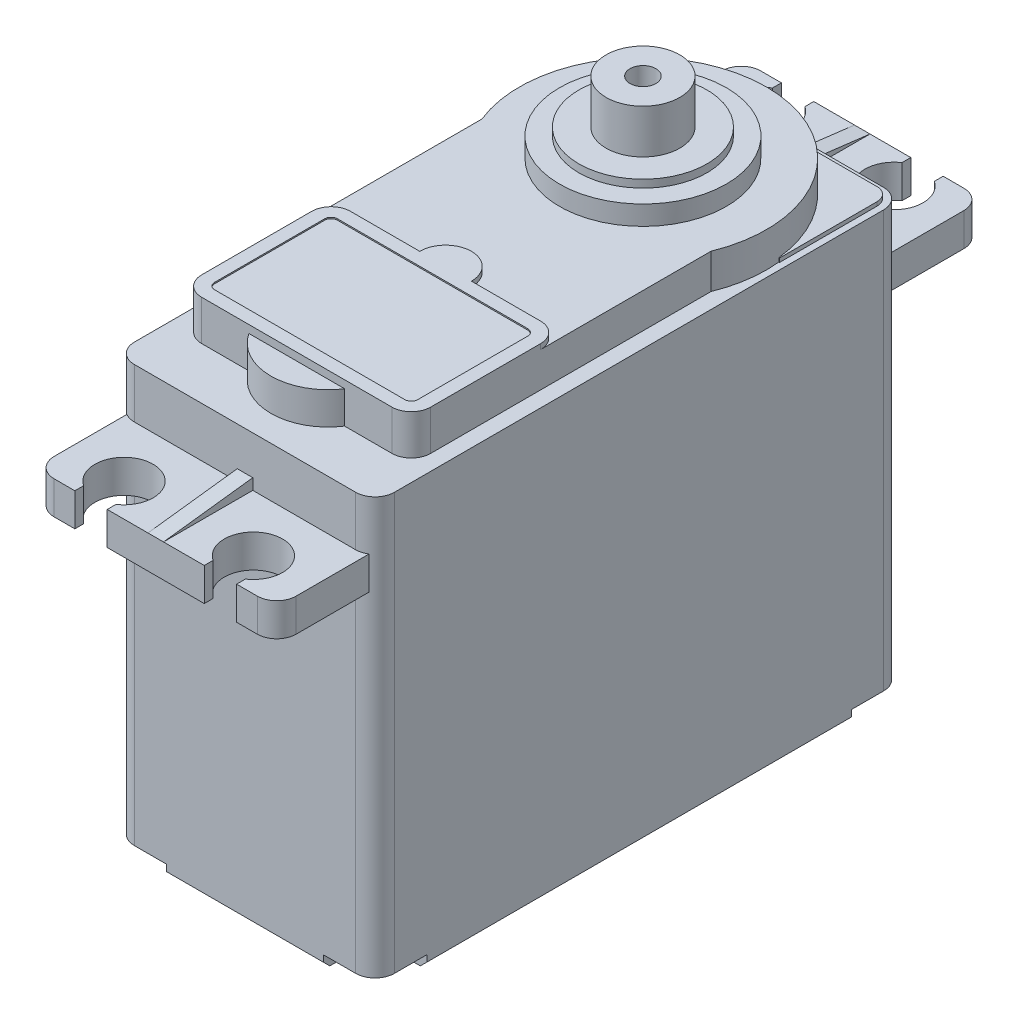
from build123d import *

# Parameters (mm, degrees)
BOSS_EXTRUDE1_DEPTH  = 33.2
BOSS_EXTRUDE2_DEPTH  = 2.55
BOSS_EXTRUDE11_DEPTH = 0.3
BOSS_EXTRUDE3_DEPTH  = 2.7
SKETCH6_R            = 4.4225
BOSS_EXTRUDE4_DEPTH  = 2.5
SKETCH7_R            = 6.45
BOSS_EXTRUDE5_DEPTH  = 1.5
SKETCH8_R            = 4.95
BOSS_EXTRUDE6_DEPTH  = 0.6
SKETCH10_R           = 2.85
BOSS_EXTRUDE7_DEPTH  = 3.4
SKETCH12_R           = 1
CUT_EXTRUDE1_DEPTH   = 5
BOSS_EXTRUDE9_DEPTH  = 0.4
BOSS_EXTRUDE10_DEPTH = 0.3
CHAMFER1_SIZE        = 0.5
CUT_EXTRUDE2_DEPTH   = 1
MIRROR2_COPY_1_DEPTH = 1
BOSS_EXTRUDE12_DEPTH = 0.6


with BuildPart() as part:
    # Sketch1 → Boss-Extrude1 (new body)
    with BuildSketch(Plane(origin=(0, 0, 0), x_dir=(1, 0, 0), z_dir=(0, 1, 0))):
        with BuildLine():
            Line((-8.55, -25.58), (8.55, -25.58))
            ThreePointArc((8.55, -25.58), (9.610660172, -25.140660172), (10.05, -24.08))
            Line((10.05, -24.08), (10.05, 13.72))
            ThreePointArc((10.05, 13.72), (9.610660172, 14.780660172), (8.55, 15.22))
            Line((8.55, 15.22), (-8.55, 15.22))
            ThreePointArc((-8.55, 15.22), (-9.610660172, 14.780660172), (-10.05, 13.72))
            Line((-10.05, 13.72), (-10.05, -24.08))
            ThreePointArc((-10.05, -24.08), (-9.610660172, -25.140660172), (-8.55, -25.58))
        make_face()
    extrude(amount=BOSS_EXTRUDE1_DEPTH)

    # Sketch4 → Boss-Extrude2 (add)
    with BuildSketch(Plane(origin=(0, 26.8, 0), x_dir=(1, 0, 0), z_dir=(0, 1, 0))):
        with BuildLine():
            Line((-6.25, 22.12), (-6.25, 21.440828693))
            ThreePointArc((-6.25, 21.440828693), (-5, 17.32), (-3.75, 21.440828693))
            Line((-3.75, 21.440828693), (-3.75, 22.12))
            Line((-3.75, 22.12), (3.75, 22.12))
            Line((3.75, 22.12), (3.75, 21.440828693))
            ThreePointArc((3.75, 21.440828693), (5, 17.32), (6.25, 21.440828693))
            Line((6.25, 21.440828693), (6.25, 22.12))
            Line((6.25, 22.12), (7.85, 22.12))
            ThreePointArc((7.85, 22.12), (8.910660172, 21.680660172), (9.35, 20.62))
            Line((9.35, 20.62), (9.35, -30.98))
            ThreePointArc((9.35, -30.98), (8.910660172, -32.040660172), (7.85, -32.48))
            Line((7.85, -32.48), (6.25, -32.48))
            Line((6.25, -32.48), (6.25, -31.800828693))
            ThreePointArc((6.25, -31.800828693), (5, -27.68), (3.75, -31.800828693))
            Line((3.75, -31.800828693), (3.75, -32.48))
            Line((3.75, -32.48), (-3.75, -32.48))
            Line((-3.75, -32.48), (-3.75, -31.800828693))
            ThreePointArc((-3.75, -31.800828693), (-5, -27.68), (-6.25, -31.800828693))
            Line((-6.25, -31.800828693), (-6.25, -32.48))
            Line((-6.25, -32.48), (-7.85, -32.48))
            ThreePointArc((-7.85, -32.48), (-8.910660172, -32.040660172), (-9.35, -30.98))
            Line((-9.35, -30.98), (-9.35, 20.62))
            ThreePointArc((-9.35, 20.62), (-8.910660172, 21.680660172), (-7.85, 22.12))
            Line((-7.85, 22.12), (-6.25, 22.12))
        make_face()
    extrude(amount=BOSS_EXTRUDE2_DEPTH)

    # Sketch16 → Boss-Extrude11 (add)
    with BuildSketch(Plane(origin=(0, 33.2, 0), x_dir=(1, 0, 0), z_dir=(0, 1, 0))):
        with BuildLine():
            Line((-9.55, 13.72), (-9.55, 6.17))
            Line((-9.55, 6.17), (9.55, 6.17))
            Line((9.55, 6.17), (9.55, 13.72))
            ThreePointArc((9.55, 13.72), (9.257106781, 14.427106781), (8.55, 14.72))
            Line((8.55, 14.72), (-8.55, 14.72))
            ThreePointArc((-8.55, 14.72), (-9.257106781, 14.427106781), (-9.55, 13.72))
        make_face()
    extrude(amount=BOSS_EXTRUDE11_DEPTH)

    # Sketch5 → Boss-Extrude3 (add)
    with BuildSketch(Plane(origin=(0, 33.2, 0), x_dir=(1, 0, 0), z_dir=(0, 1, 0))):
        with BuildLine():
            Line((-8.85, 1.581128311), (-8.85, -20.08))
            ThreePointArc((-8.85, -20.08), (-8.410660172, -21.140660172), (-7.35, -21.58))
            Line((-7.35, -21.58), (7.35, -21.58))
            ThreePointArc((7.35, -21.58), (8.410660172, -21.140660172), (8.85, -20.08))
            Line((8.85, -20.08), (8.85, 1.581128311))
            ThreePointArc((8.85, 1.581128311), (0, 14.72), (-8.85, 1.581128311))
        make_face()
    extrude(amount=BOSS_EXTRUDE3_DEPTH)

    # Sketch6 → Boss-Extrude4 (add)
    with BuildSketch(Plane(origin=(0, 33.2, 0), x_dir=(1, 0, 0), z_dir=(0, 1, 0))):
        with Locations((0, -19.1575)):
            Circle(SKETCH6_R)
    extrude(amount=BOSS_EXTRUDE4_DEPTH)

    # Sketch7 → Boss-Extrude5 (add)
    with BuildSketch(Plane(origin=(0, 35.9, 0), x_dir=(1, 0, 0), z_dir=(0, 1, 0))):
        with Locations((0, 5.17)):
            Circle(SKETCH7_R)
    extrude(amount=BOSS_EXTRUDE5_DEPTH)

    # Sketch8 → Boss-Extrude6 (add)
    with BuildSketch(Plane(origin=(0, 37.4, 0), x_dir=(1, 0, 0), z_dir=(0, 1, 0))):
        with Locations((0, 5.17)):
            Circle(SKETCH8_R)
    extrude(amount=BOSS_EXTRUDE6_DEPTH)

    # Sketch10 → Boss-Extrude7 (add)
    with BuildSketch(Plane(origin=(0, 38, 0), x_dir=(1, 0, 0), z_dir=(0, 1, 0))):
        with Locations((0, 5.17)):
            Circle(SKETCH10_R)
    extrude(amount=BOSS_EXTRUDE7_DEPTH)

    # Sketch12 → Cut-Extrude1 (cut)
    with BuildSketch(Plane(origin=(0, 41.4, 0), x_dir=(1, 0, 0), z_dir=(0, 1, 0))):
        with Locations((0, 5.17)):
            Circle(SKETCH12_R)
    extrude(amount=-CUT_EXTRUDE1_DEPTH, mode=Mode.SUBTRACT)

    # Sketch13 → Boss-Extrude9 (add)
    with BuildSketch(Plane(origin=(0, 35.9, 0), x_dir=(1, 0, 0), z_dir=(0, 1, 0))):
        with BuildLine():
            Line((-8.85, -11.58), (-8.85, -20.08))
            ThreePointArc((-8.85, -20.08), (-8.410660172, -21.140660172), (-7.35, -21.58))
            Line((-7.35, -21.58), (7.35, -21.58))
            ThreePointArc((7.35, -21.58), (8.410660172, -21.140660172), (8.85, -20.08))
            Line((8.85, -20.08), (8.85, -11.58))
            ThreePointArc((8.85, -11.58), (8.410660172, -10.519339828), (7.35, -10.08))
            Line((7.35, -10.08), (2, -10.08))
            ThreePointArc((2, -10.08), (0, -8.08), (-2, -10.08))
            Line((-2, -10.08), (-7.35, -10.08))
            ThreePointArc((-7.35, -10.08), (-8.410660172, -10.519339828), (-8.85, -11.58))
        make_face()
        with BuildLine():
            Line((-7.85, -11.58), (-7.85, -20.08))
            ThreePointArc((-7.85, -20.08), (-7.703553391, -20.433553391), (-7.35, -20.58))
            Line((-7.35, -20.58), (7.35, -20.58))
            ThreePointArc((7.35, -20.58), (7.703553391, -20.433553391), (7.85, -20.08))
            Line((7.85, -20.08), (7.85, -11.58))
            ThreePointArc((7.85, -11.58), (7.703553391, -11.226446609), (7.35, -11.08))
            Line((7.35, -11.08), (-7.35, -11.08))
            ThreePointArc((-7.35, -11.08), (-7.703553391, -11.226446609), (-7.85, -11.58))
        make_face(mode=Mode.SUBTRACT)
    extrude(amount=BOSS_EXTRUDE9_DEPTH)

    # Sketch14 → Boss-Extrude10 (add)
    with BuildSketch(Plane(origin=(0, 35.9, 0), x_dir=(1, 0, 0), z_dir=(0, 1, 0))):
        with BuildLine():
            Line((-7.85, -11.58), (-7.85, -20.08))
            ThreePointArc((-7.85, -20.08), (-7.703553391, -20.433553391), (-7.35, -20.58))
            Line((-7.35, -20.58), (7.35, -20.58))
            ThreePointArc((7.35, -20.58), (7.703553391, -20.433553391), (7.85, -20.08))
            Line((7.85, -20.08), (7.85, -11.58))
            ThreePointArc((7.85, -11.58), (7.703553391, -11.226446609), (7.35, -11.08))
            Line((7.35, -11.08), (-7.35, -11.08))
            ThreePointArc((-7.35, -11.08), (-7.703553391, -11.226446609), (-7.85, -11.58))
        make_face()
    extrude(amount=BOSS_EXTRUDE10_DEPTH)

    # Chamfer1
    chamfer1_edges = [part.edges().sort_by_distance(p)[0] for p in [
        (-10.05, 0, 5.18),
        (-9.610660172, 0, 25.140660172),
        (0, 0, 25.58),
        (9.610660172, 0, 25.140660172),
        (10.05, 0, 5.18),
        (9.610660172, 0, -14.780660172),
        (0, 0, -15.22),
        (-9.610660172, 0, -14.780660172),
    ]]
    chamfer(chamfer1_edges, length=CHAMFER1_SIZE)

    # Sketch17 → Cut-Extrude2 (cut)
    with BuildSketch(Plane.XZ):
        with BuildLine():
            Line((-10.05, 21.58), (-10.05, 24.08))
            ThreePointArc((-10.05, 24.08), (-9.610660172, 25.140660172), (-8.55, 25.58))
            Line((-8.55, 25.58), (-6.05, 25.58))
            Line((-6.05, 25.58), (-6.05, 23.08))
            ThreePointArc((-6.05, 23.08), (-6.489339828, 22.019339828), (-7.55, 21.58))
            Line((-7.55, 21.58), (-10.05, 21.58))
        make_face()
    cut_extrude2 = extrude(amount=-CUT_EXTRUDE2_DEPTH, mode=Mode.SUBTRACT)

    # Mirror1: Cut-Extrude2 across plane
    add(cut_extrude2.mirror(Plane(origin=(0, 0, 0), x_dir=(0, 0, 1), z_dir=(1, 0, 0))), mode=Mode.SUBTRACT)

    # Mirror2: Cut-Extrude2 across plane
    add(cut_extrude2.mirror(Plane.XY.offset(5.18)), mode=Mode.SUBTRACT)

    # Mirror2 copy 1 sketch → Mirror2 copy 1 (cut)
    with BuildSketch(Plane(origin=(0, 0, 10.36), x_dir=(-1, 0, 0), z_dir=(0, -1, 0))):
        with BuildLine():
            Line((-10.05, 21.58), (-10.05, 24.08))
            ThreePointArc((-10.05, 24.08), (-9.610660172, 25.140660172), (-8.55, 25.58))
            Line((-8.55, 25.58), (-6.05, 25.58))
            Line((-6.05, 25.58), (-6.05, 23.08))
            ThreePointArc((-6.05, 23.08), (-6.489339828, 22.019339828), (-7.55, 21.58))
            Line((-7.55, 21.58), (-10.05, 21.58))
        make_face()
    extrude(amount=-MIRROR2_COPY_1_DEPTH, mode=Mode.SUBTRACT)

    # Sketch19 → Boss-Extrude12 (add, symmetric)
    with BuildSketch(Plane(origin=(0, 0, 0), x_dir=(0, 0, -1), z_dir=(1, 0, 0))):
        Polygon((-25.58, 30.2), (-25.58, 29.35), (-32.48, 29.35), align=None)
        Polygon((15.22, 30.2), (15.22, 29.35), (22.12, 29.35), align=None)
    extrude(amount=BOSS_EXTRUDE12_DEPTH, both=True)


solid = part.part
